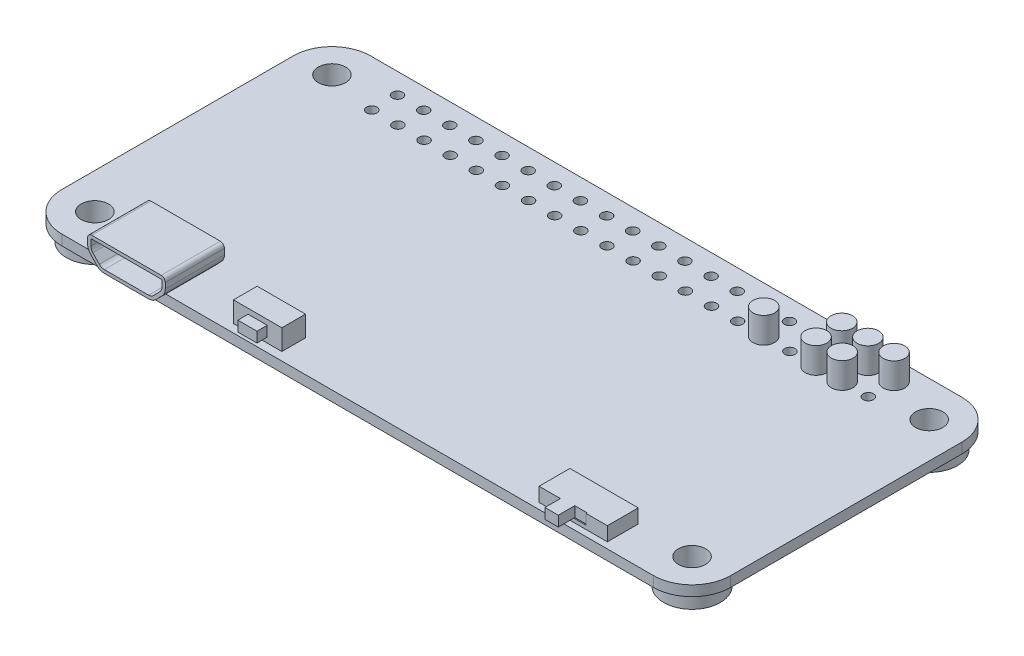
from build123d import *

# Parameters (mm, degrees)
BOSS_EXTRUDE1_DEPTH      = 1
SKETCH2_R                = 1.325
CUT_EXTRUDE1_DEPTH       = 36.80851854
SKETCH3_R                = 0.5
CUT_EXTRUDE2_DEPTH       = 36.80851854
LPATTERN1_COUNT          = 20
LPATTERN1_PITCH          = 2.54
BOSS_EXTRUDE6_DEPTH      = 1.25
BOSS_EXTRUDE6_DEPTH_BACK = 4.5
CUT_EXTRUDE9_DEPTH       = 5.25
SKETCH_1_W               = 4.7
SKETCH_1_H               = 2.3
EXTRUDE_1_DEPTH          = 2
SKETCH_2_W               = 1.86
SKETCH_2_H               = 1
EXTRUDE_2_DEPTH          = 1
SKETCH_6_W               = 6.64
SKETCH_6_H               = 3
EXTRUDE_6_DEPTH          = 1.36
SKETCH_7_W               = 2.5
SKETCH_7_H               = 1
CUT_EXTRUDE_1_DEPTH      = 0.1
SKETCH_8_W               = 1.3
SKETCH_8_H               = 1
EXTRUDE_7_DEPTH          = 1.6
SKETCH_9_R               = 2.75
SKETCH_9_R_2             = 1.325
EXTRUDE_8_DEPTH          = 1.5
SKETCH_10_R              = 1.05
EXTRUDE_9_DEPTH          = 2.5
SKETCH_11_R              = 0.5
EXTRUDE_10_DEPTH         = 3


with BuildPart() as part:
    # Sketch1 → Boss-Extrude1 (new body)
    with BuildSketch(Plane(origin=(0, 0, 0), x_dir=(1, 0, 0), z_dir=(0, 1, 0))):
        with BuildLine():
            Line((-28.75, 15), (28.75, 15))
            ThreePointArc((28.75, 15), (31.401650429, 13.901650429), (32.5, 11.25))
            Line((32.5, 11.25), (32.5, -11.25))
            ThreePointArc((32.5, -11.25), (31.401650429, -13.901650429), (28.75, -15))
            Line((28.75, -15), (-28.75, -15))
            ThreePointArc((-28.75, -15), (-31.401650429, -13.901650429), (-32.5, -11.25))
            Line((-32.5, -11.25), (-32.5, 11.25))
            ThreePointArc((-32.5, 11.25), (-31.401650429, 13.901650429), (-28.75, 15))
        make_face()
    extrude(amount=BOSS_EXTRUDE1_DEPTH)

    # Sketch2 → Cut-Extrude1 (cut, through all)
    with BuildSketch(Plane(origin=(0, 1, 0), x_dir=(1, 0, 0), z_dir=(0, 1, 0))):
        with Locations((-29.025, 11.525)):
            Circle(SKETCH2_R)
        with Locations((29.025, 11.525)):
            Circle(SKETCH2_R)
        with Locations((29.025, -11.525)):
            Circle(SKETCH2_R)
        with Locations((-29.025, -11.525)):
            Circle(SKETCH2_R)
    extrude(amount=-CUT_EXTRUDE1_DEPTH, mode=Mode.SUBTRACT)

    # Sketch3 → Cut-Extrude2 (cut, through all)
    with BuildSketch(Plane(origin=(0, 1, 0), x_dir=(1, 0, 0), z_dir=(0, 1, 0))):
        with Locations((-24.128, 13)):
            Circle(SKETCH3_R)
        with Locations((-24.128, 10.5)):
            Circle(SKETCH3_R)
    cut_extrude2 = extrude(amount=-CUT_EXTRUDE2_DEPTH, mode=Mode.SUBTRACT)

    # LPattern1: Cut-Extrude2 ×20
    with Locations(*[(i * LPATTERN1_PITCH, 0, 0) for i in range(1, LPATTERN1_COUNT)]):
        add(cut_extrude2, mode=Mode.SUBTRACT)

    # Sketch15 → Boss-Extrude6 (add, two sides: drawn at the far end of the back side and taken through both)
    with BuildSketch(Plane.XY.offset(15).offset(-BOSS_EXTRUDE6_DEPTH_BACK)):
        with BuildLine():
            Line((-24.6, 3.6), (-17.85, 3.6))
            ThreePointArc((-17.85, 3.6), (-17.567157288, 3.482842712), (-17.45, 3.2))
            Line((-17.45, 3.2), (-17.45, 2.652310288))
            ThreePointArc((-17.45, 2.652310288), (-17.522264229, 2.279072643), (-17.728612679, 1.959778459))
            Line((-17.728612679, 1.959778459), (-18.354830555, 1.307468172))
            ThreePointArc((-18.354830555, 1.307468172), (-18.684128491, 1.080072876), (-19.076217876, 1))
            Line((-19.076217876, 1), (-23.373782124, 1))
            ThreePointArc((-23.373782124, 1), (-23.765871509, 1.080072876), (-24.095169445, 1.307468172))
            Line((-24.095169445, 1.307468172), (-24.721387321, 1.959778459))
            ThreePointArc((-24.721387321, 1.959778459), (-24.927735771, 2.279072643), (-25, 2.652310288))
            Line((-25, 2.652310288), (-25, 3.2))
            ThreePointArc((-25, 3.2), (-24.882842712, 3.482842712), (-24.6, 3.6))
        make_face()
    extrude(amount=BOSS_EXTRUDE6_DEPTH + BOSS_EXTRUDE6_DEPTH_BACK)

    # Sketch16 → Cut-Extrude9 (cut)
    with BuildSketch(Plane.XY.offset(16.25)):
        with BuildLine():
            Line((-18.585674498, 1.529078357), (-17.959456622, 2.181388644))
            ThreePointArc((-17.959456622, 2.181388644), (-17.819139676, 2.398508689), (-17.77, 2.652310288))
            Line((-17.77, 2.652310288), (-17.77, 3.2))
            ThreePointArc((-17.77, 3.2), (-17.793431458, 3.256568542), (-17.85, 3.28))
            Line((-17.85, 3.28), (-24.6, 3.28))
            ThreePointArc((-24.6, 3.28), (-24.656568542, 3.256568542), (-24.68, 3.2))
            Line((-24.68, 3.2), (-24.68, 2.652310288))
            ThreePointArc((-24.68, 2.652310288), (-24.630860324, 2.398508689), (-24.490543378, 2.181388644))
            Line((-24.490543378, 2.181388644), (-23.864325502, 1.529078357))
            ThreePointArc((-23.864325502, 1.529078357), (-23.640402906, 1.374449555), (-23.373782124, 1.32))
            Line((-23.373782124, 1.32), (-19.076217876, 1.32))
            ThreePointArc((-19.076217876, 1.32), (-18.809597094, 1.374449555), (-18.585674498, 1.529078357))
        make_face()
    extrude(amount=-CUT_EXTRUDE9_DEPTH, mode=Mode.SUBTRACT)

    # 草图1 → 凸台-拉伸1 (add)
    with BuildSketch(Plane(origin=(0, 1, 0), x_dir=(1, 0, 0), z_dir=(0, 1, 0))):
        with Locations((-10.52, -13.05)):
            Rectangle(SKETCH_1_W, SKETCH_1_H)
    extrude(amount=EXTRUDE_1_DEPTH)

    # 草图2 → 凸台-拉伸2 (add)
    with BuildSketch(Plane.XY.offset(14.2)):
        with Locations((-10.52, 2)):
            Rectangle(SKETCH_2_W, SKETCH_2_H)
    extrude(amount=EXTRUDE_2_DEPTH)

    # 草图6 → 凸台-拉伸6 (add)
    with BuildSketch(Plane(origin=(0, 1, 0), x_dir=(1, 0, 0), z_dir=(0, 1, 0))):
        with Locations((20.35, -12.9)):
            Rectangle(SKETCH_6_W, SKETCH_6_H)
    extrude(amount=EXTRUDE_6_DEPTH)

    # 草图7 → 切除-拉伸1 (cut)
    with BuildSketch(Plane.XY.offset(14.4)):
        with Locations((20.35, 1.86)):
            Rectangle(SKETCH_7_W, SKETCH_7_H)
    extrude(amount=-CUT_EXTRUDE_1_DEPTH, mode=Mode.SUBTRACT)

    # 草图8 → 凸台-拉伸7 (add)
    with BuildSketch(Plane.XY.offset(14.3)):
        with Locations((19.75, 1.86)):
            Rectangle(SKETCH_8_W, SKETCH_8_H)
    extrude(amount=EXTRUDE_7_DEPTH)

    # 草图9 → 凸台-拉伸8 (add)
    # profile 1 of 4: a face of its own
    with BuildSketch(Plane.XZ):
        with Locations((29.025, 11.525)):
            Circle(SKETCH_9_R)
        with Locations((29.025, 11.525)):
            Circle(SKETCH_9_R_2, mode=Mode.SUBTRACT)
    # profile 2 of 4: a face of its own
    with BuildSketch(Plane.XZ):
        with Locations((29.025, -11.525)):
            Circle(SKETCH_9_R)
        with Locations((29.025, -11.525)):
            Circle(SKETCH_9_R_2, mode=Mode.SUBTRACT)
    # profile 3 of 4: a face of its own
    with BuildSketch(Plane.XZ):
        with Locations((-29.025, 11.525)):
            Circle(SKETCH_9_R)
        with Locations((-29.025, 11.525)):
            Circle(SKETCH_9_R_2, mode=Mode.SUBTRACT)
    # profile 4 of 4: a face of its own
    with BuildSketch(Plane.XZ):
        with Locations((-29.025, -11.525)):
            Circle(SKETCH_9_R)
        with Locations((-29.025, -11.525)):
            Circle(SKETCH_9_R_2, mode=Mode.SUBTRACT)
    extrude(amount=EXTRUDE_8_DEPTH)

    # 草图10 → 凸台-拉伸9 (add)
    with BuildSketch(Plane(origin=(0, 1, 0), x_dir=(1, 0, 0), z_dir=(0, 1, 0))):
        with Locations((24.132, 13)):
            Circle(SKETCH_10_R)
        with Locations((21.592, 13)):
            Circle(SKETCH_10_R)
        with Locations((19.052, 13)):
            Circle(SKETCH_10_R)
        with Locations((21.592, 10.5)):
            Circle(SKETCH_10_R)
        with Locations((19.052, 10.5)):
            Circle(SKETCH_10_R)
        with Locations((13.972, 10.5)):
            Circle(SKETCH_10_R)
    extrude(amount=EXTRUDE_9_DEPTH)

    # 草图11 → 凸台-拉伸10 (add)
    with BuildSketch(Plane.XZ.offset(-1)):
        with Locations((24.132, -13)):
            Circle(SKETCH_11_R)
        with Locations((21.592, -13)):
            Circle(SKETCH_11_R)
        with Locations((21.592, -10.5)):
            Circle(SKETCH_11_R)
        with Locations((19.052, -10.5)):
            Circle(SKETCH_11_R)
        with Locations((19.052, -13)):
            Circle(SKETCH_11_R)
        with Locations((13.972, -10.5)):
            Circle(SKETCH_11_R)
    extrude(amount=EXTRUDE_10_DEPTH)


solid = part.part
